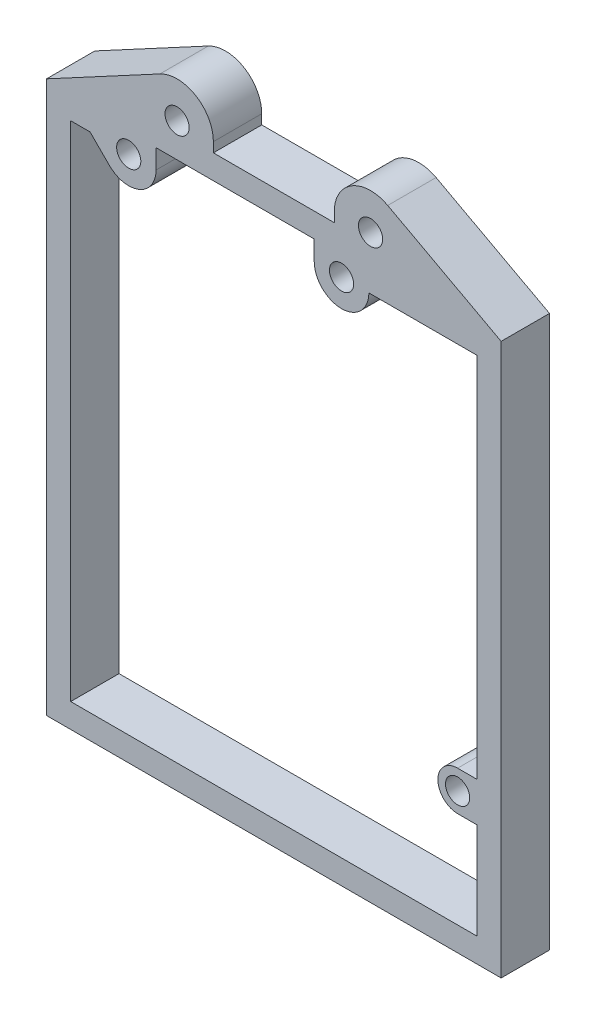
from build123d import *

# Parameters (mm, degrees)
SKETCH1_R           = 1.5875
BOSS_EXTRUDE1_DEPTH = 6.35


with BuildPart() as part:
    # Sketch1 → Boss-Extrude1 (new body)
    with BuildSketch(Plane.XY):
        with BuildLine():
            Line((13.97, -3.175), (39.37, -3.175))
            Line((39.37, -3.175), (56.515, -3.175))
            Line((56.515, -3.175), (56.515, 69.215))
            Line((56.515, 69.215), (41.625085175, 77.219758289))
            ThreePointArc((41.625085175, 77.219758289), (36.926481727, 77.112863097), (34.6075, 73.025))
            Line((34.6075, 73.025), (34.6075, 71.755))
            Line((34.6075, 71.755), (18.7325, 71.755))
            Line((18.7325, 71.755), (18.7325, 73.025))
            ThreePointArc((18.7325, 73.025), (16.413518273, 77.112863097), (11.714914825, 77.219758289))
            Line((11.714914825, 77.219758289), (-3.175, 69.215))
            Line((-3.175, 69.215), (-3.175, -3.175))
            Line((-3.175, -3.175), (13.97, -3.175))
        make_face()
        with Locations((35.56, 66.04)):
            Circle(SKETCH1_R, mode=Mode.SUBTRACT)
        with Locations((7.62, 66.04)):
            Circle(SKETCH1_R, mode=Mode.SUBTRACT)
        with Locations((50.8, 15.24)):
            Circle(SKETCH1_R, mode=Mode.SUBTRACT)
        with Locations((39.37, 73.025)):
            Circle(SKETCH1_R, mode=Mode.SUBTRACT)
        with Locations((13.97, 73.025)):
            Circle(SKETCH1_R, mode=Mode.SUBTRACT)
        with BuildLine():
            Line((0, 11.093834149), (0, 16.5575))
            Line((0, 16.5575), (0, 66.04))
            Line((0, 66.04), (2.54, 66.04))
            Line((2.54, 66.04), (5.08, 63.506513025))
            ThreePointArc((5.08, 63.506513025), (8.990749111, 62.724701654), (11.2075, 66.04))
            Line((11.2075, 66.04), (11.2075, 68.58))
            Line((11.2075, 68.58), (31.9725, 68.58))
            Line((31.9725, 68.58), (31.9725, 66.04))
            ThreePointArc((31.9725, 66.04), (35.56, 62.4525), (39.1475, 66.04))
            Line((39.1475, 66.04), (40.386, 66.04))
            Line((40.386, 66.04), (53.34, 66.04))
            Line((53.34, 66.04), (53.34, 17.8275))
            Line((53.34, 17.8275), (50.8, 17.8275))
            ThreePointArc((50.8, 17.8275), (48.2125, 15.24), (50.8, 12.6525))
            Line((50.8, 12.6525), (53.34, 12.6525))
            Line((53.34, 12.6525), (53.34, 0))
            Line((53.34, 0), (0, 0))
            Line((0, 0), (0, 11.093834149))
        make_face(mode=Mode.SUBTRACT)
    extrude(amount=BOSS_EXTRUDE1_DEPTH)


solid = part.part
